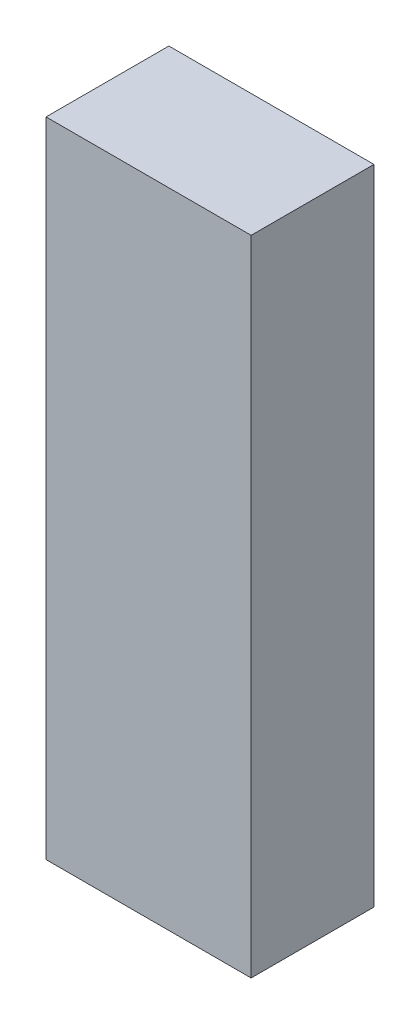
from build123d import *

# Parameters (mm, degrees)
SKETCH1_W           = 40.493891915
SKETCH1_H           = 24.251425102
BOSS_EXTRUDE1_DEPTH = 127


with BuildPart() as part:
    # Sketch1 → Boss-Extrude1 (new body)
    with BuildSketch(Plane(origin=(0, 0, 0), x_dir=(1, 0, 0), z_dir=(0, 1, 0))):
        with Locations((20.246945958, 12.125712551)):
            Rectangle(SKETCH1_W, SKETCH1_H)
    extrude(amount=BOSS_EXTRUDE1_DEPTH)


solid = part.part
